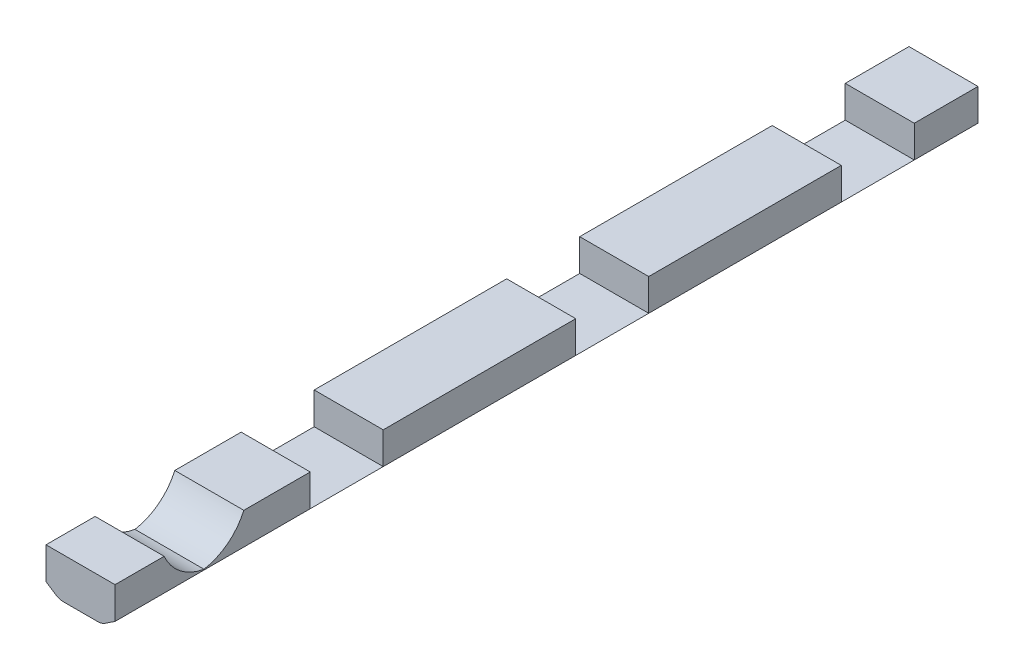
from build123d import *

# Parameters (mm, degrees)
BOSS_EXTRUDE1_DEPTH = 65
SKETCH2_W           = 5.5
SKETCH2_H           = 2.4
CUT_EXTRUDE1_DEPTH  = 6
LPATTERN1_COUNT     = 3
LPATTERN1_PITCH     = 20
SKETCH3_W           = 6
SKETCH3_H           = 2.4
CUT_EXTRUDE2_DEPTH  = 6
FILLET1_R           = 4
FILLET2_R           = 4
FILLET3_R           = 1
FILLET4_R           = 1


with BuildPart() as part:
    # Sketch1 → Boss-Extrude1 (new body)
    with BuildSketch(Plane.XY):
        Polygon((0, 0), (3.2, 0), (4.2, 0.663324958), (4.2, 3.063324958), (-1, 3.063324958), (-1, 0.663324958), align=None)
    extrude(amount=BOSS_EXTRUDE1_DEPTH)

    # Sketch2 → Cut-Extrude1 (cut)
    with BuildSketch(Plane.ZY.offset(1)):
        with Locations((7.55, 1.863324958)):
            Rectangle(SKETCH2_W, SKETCH2_H)
    cut_extrude1 = extrude(amount=-CUT_EXTRUDE1_DEPTH, mode=Mode.SUBTRACT)

    # LPattern1: Cut-Extrude1 ×3
    with Locations(*[(0, 0, i * LPATTERN1_PITCH) for i in range(1, LPATTERN1_COUNT)]):
        add(cut_extrude1, mode=Mode.SUBTRACT)

    # Sketch3 → Cut-Extrude2 (cut)
    with BuildSketch(Plane.ZY.offset(1)):
        with Locations((58.3, 1.863324958)):
            Rectangle(SKETCH3_W, SKETCH3_H)
    extrude(amount=-CUT_EXTRUDE2_DEPTH, mode=Mode.SUBTRACT)

    # Fillet1
    # the kernel refuses this fillet: 4 mm, written as the material it adds along each edge
    with BuildSketch(Plane(origin=(-1, 0.663324958, 55.3), x_dir=(0, 0, 1), z_dir=(1, 0, 0))) as fillet1_piece_1_section:
        with BuildLine():
            CenterArc((3.666060556, -4), FILLET1_R, 90, 66.421821522)
            Line((0, -2.4), (-0.073321211, -2.368))
            ThreePointArc((-0.073321211, -2.368), (-0.08, -1.2), (-0.08, 0))
            Line((-0.08, 0), (0, 0.08))
            Line((0, 0.08), (3.666060556, 0.08))
            Line((3.666060556, 0.08), (3.666060556, 0))
        make_face()
    fillet1_piece_1 = extrude(amount=5.2, mode=Mode.PRIVATE)
    fillet1_piece_1 = split(fillet1_piece_1, bisect_by=Plane(origin=(0.518931728, -0.344220367, 56.190586237), z_dir=(0.5527707983925672, 0.833333333333333, 0)), keep=Keep.TOP, mode=Mode.PRIVATE)
    fillet1_piece_1 = split(fillet1_piece_1, bisect_by=Plane(origin=(2.681068272, -0.344220367, 56.190586237), z_dir=(-0.5527707983925666, 0.8333333333333335, 0)), keep=Keep.TOP, mode=Mode.PRIVATE)
    add(fillet1_piece_1)

    # Fillet2
    # the kernel refuses this fillet: 4 mm, written as the material it adds along each edge
    with BuildSketch(Plane(origin=(-1, 0.663324958, 61.3), x_dir=(0, 1, 0), z_dir=(1, 0, 0))) as fillet2_piece_1_section:
        with BuildLine():
            CenterArc((4, -3.666060556), FILLET2_R, 113.578178478, 66.421821522)
            Line((0, -3.666060556), (-0.08, -3.666060556))
            Line((-0.08, -3.666060556), (-0.08, 0))
            Line((-0.08, 0), (0, 0.08))
            ThreePointArc((0, 0.08), (1.2, 0.08), (2.368, 0.073321211))
            Line((2.368, 0.073321211), (2.4, 0))
        make_face()
    fillet2_piece_1 = extrude(amount=5.2, mode=Mode.PRIVATE)
    fillet2_piece_1 = split(fillet2_piece_1, bisect_by=Plane(origin=(2.681068272, -0.344220367, 60.409413763), z_dir=(-0.5527707983925666, 0.8333333333333335, 0)), keep=Keep.TOP, mode=Mode.PRIVATE)
    fillet2_piece_1 = split(fillet2_piece_1, bisect_by=Plane(origin=(0.518931728, -0.344220367, 60.409413763), z_dir=(0.5527707983925672, 0.833333333333333, 0)), keep=Keep.TOP, mode=Mode.PRIVATE)
    add(fillet2_piece_1)

    # Fillet3
    fillet3_edges = [part.edges().sort_by_distance(p)[0] for p in [
        (3.2, 0, 32.5),
    ]]
    fillet(fillet3_edges, radius=FILLET3_R)

    # Fillet4
    fillet4_edges = [part.edges().sort_by_distance(p)[0] for p in [
        (0, 0, 32.5),
    ]]
    fillet(fillet4_edges, radius=FILLET4_R)


solid = part.part
